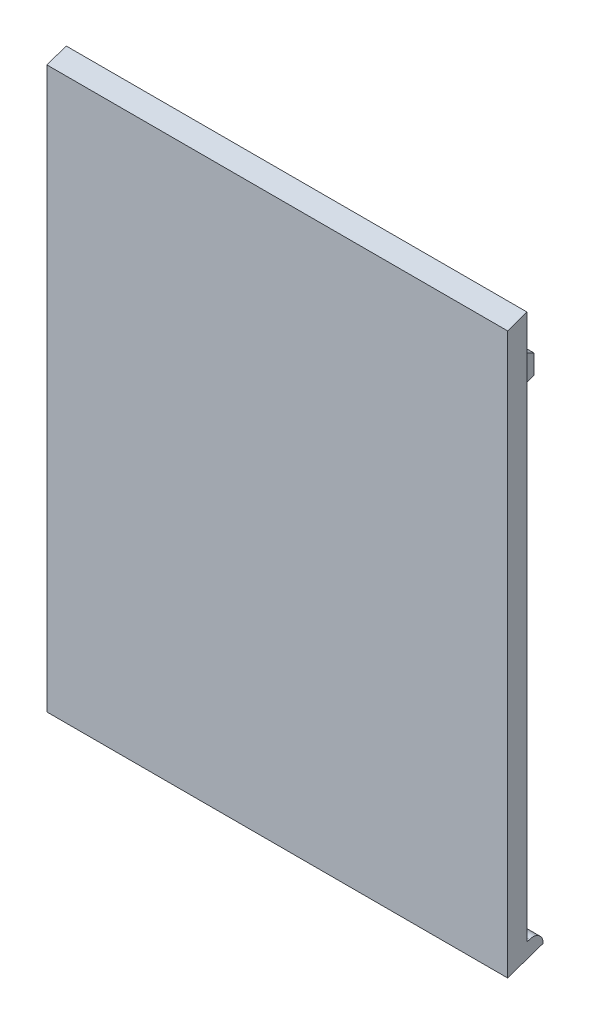
from build123d import *
from OCP.BRepFilletAPI import BRepFilletAPI_MakeChamfer

# Parameters (mm, degrees)
SALIENTE_EXTRUIR1_START   = -112.716536218
SALIENTE_EXTRUIR1_DEPTH   = 135
SALIENTE_EXTRUIR2_START   = -105.966536218
SALIENTE_EXTRUIR2_DEPTH   = 3
SALIENTE_EXTRUIR2_START_2 = 12.533463782
SALIENTE_EXTRUIR2_2_DEPTH = 3
SALIENTE_EXTRUIR2_START_3 = -102.966536218
SALIENTE_EXTRUIR2_3_DEPTH = 115.5
SALIENTE_EXTRUIR2_START_4 = -109.155348963
SALIENTE_EXTRUIR2_4_DEPTH = 3
SALIENTE_EXTRUIR2_START_5 = 15.722276527
SALIENTE_EXTRUIR2_5_DEPTH = 3
SALIENTE_EXTRUIR2_START_6 = -106.155348963
SALIENTE_EXTRUIR2_6_DEPTH = 0.188812745
SALIENTE_EXTRUIR2_START_7 = 15.533463782
SALIENTE_EXTRUIR2_7_DEPTH = 0.188812745
CORTAR_EXTRUIR1_DEPTH     = 142
SALIENTE_EXTRUIR3_START   = -67.100694653
SALIENTE_EXTRUIR3_DEPTH   = 43.76831687
CORTAR_EXTRUIR2_DEPTH     = 52
CHAFL_N1_SIZE             = 1
CHAFL_N1_SIZE2            = 0.786933748
CHAFL_N2_SIZE             = 1
CHAFL_N2_SIZE2            = 1.611265726
CHAFL_N3_SIZE             = 4
CHAFL_N3_SIZE2            = 3.141527632
CORTAR_EXTRUIR3_DEPTH     = 243
CHAFL_N4_SIZE             = 2
CHAFL_N4_SIZE2            = 1.425175398
CROQUIS7_W                = 135
CROQUIS7_H                = 4.35404101
SALIENTE_EXTRUIR4_DEPTH   = 5
REDONDEO1_R               = 3
SALIENTE_EXTRUIR5_DEPTH   = 8
CORTAR_EXTRUIR4_DEPTH     = 16
REDONDEO2_R               = 3
CORTAR_EXTRUIR5_START     = -9.75
CORTAR_EXTRUIR5_DEPTH     = 115.5
CROQUIS11_R               = 3.5
CROQUIS11_R_2             = 2
CROQUIS11_R_3             = 3
CROQUIS11_R_4             = 1.25
CROQUIS11_R_5             = 2.750806456
SALIENTE_EXTRUIR6_DEPTH   = 5


# Read off the part's stored shape, not the designer's step: Saliente-Extruir1, Saliente-Extruir2, Saliente-Extruir3
with BuildPart() as part:
    # Saliente-Extruir1 outline → Saliente-Extruir1 (new body)
    with BuildSketch(Plane.YZ.offset(SALIENTE_EXTRUIR1_START)):
        Polygon((-94.607382532, 5.674155302), (-92.657007797, 0), (71.548186707, 0), (69.597811972, 5.674155302), align=None)
    extrude(amount=SALIENTE_EXTRUIR1_DEPTH)

    # Saliente-Extruir2 outline → Saliente-Extruir2 (add)
    with BuildSketch(Plane.YZ.offset(SALIENTE_EXTRUIR2_START)):
        Polygon((-88.302966787, 0), (-86.352592053, -5.674155302), (53.883350011, -5.674155302), (51.932975277, 0), align=None)
    extrude(amount=SALIENTE_EXTRUIR2_DEPTH)

    # Saliente-Extruir2 2 outline → Saliente-Extruir2 2 (add)
    with BuildSketch(Plane.YZ.offset(SALIENTE_EXTRUIR2_START_2)):
        Polygon((-88.302966787, 0), (-86.352592053, -5.674155302), (53.883350011, -5.674155302), (51.932975277, 0), align=None)
    extrude(amount=SALIENTE_EXTRUIR2_2_DEPTH)

    # Saliente-Extruir2 3 outline → Saliente-Extruir2 3 (add)
    with BuildSketch(Plane.YZ.offset(SALIENTE_EXTRUIR2_START_3)):
        Polygon((-85.302966787, 0), (-88.302966787, 0), (-86.352592053, -5.674155302), (-83.352592053, -5.674155302), align=None)
    extrude(amount=SALIENTE_EXTRUIR2_3_DEPTH)

    # Saliente-Extruir2 4 outline → Saliente-Extruir2 4 (add)
    with BuildSketch(Plane.YZ.offset(SALIENTE_EXTRUIR2_START_4)):
        Polygon((48.932975277, 0), (50.883350011, -5.674155302), (63.313045378, -5.674155302), (61.362670643, 0), align=None)
    extrude(amount=SALIENTE_EXTRUIR2_4_DEPTH)

    # Saliente-Extruir2 5 outline → Saliente-Extruir2 5 (add)
    with BuildSketch(Plane.YZ.offset(SALIENTE_EXTRUIR2_START_5)):
        Polygon((48.932975277, 0), (50.883350011, -5.674155302), (63.313045378, -5.674155302), (61.362670643, 0), align=None)
    extrude(amount=SALIENTE_EXTRUIR2_5_DEPTH)

    # Saliente-Extruir2 6 outline → Saliente-Extruir2 6 (add)
    with BuildSketch(Plane.YZ.offset(SALIENTE_EXTRUIR2_START_6)):
        Polygon((51.932975277, 0), (48.932975277, 0), (50.883350011, -5.674155302), (53.883350011, -5.674155302), align=None)
    extrude(amount=SALIENTE_EXTRUIR2_6_DEPTH)

    # Saliente-Extruir2 7 outline → Saliente-Extruir2 7 (add)
    with BuildSketch(Plane.YZ.offset(SALIENTE_EXTRUIR2_START_7)):
        Polygon((51.932975277, 0), (48.932975277, 0), (50.883350011, -5.674155302), (53.883350011, -5.674155302), align=None)
    extrude(amount=SALIENTE_EXTRUIR2_7_DEPTH)

    # Croquis3 → Cortar-Extruir1 (cut)
    with BuildSketch(Plane(origin=(18.722276527, 0, 0), x_dir=(0, 0, -1), z_dir=(1, 0, 0))):
        Polygon((5.674155302, 59.663045378), (0, 57.686858925), (0, 61.691536691), (6.106990738, 63.936404196), (5.897646794, 59.689197808), align=None)
    extrude(amount=-CORTAR_EXTRUIR1_DEPTH, mode=Mode.SUBTRACT)

    # Saliente-Extruir3 outline → Saliente-Extruir3 (add)
    with BuildSketch(Plane.YZ.offset(SALIENTE_EXTRUIR3_START)):
        Polygon((67.89512648, -3.782770202), (66.594876657, 0), (64.112670643, 0), (65.412920466, -3.782770202), align=None)
    extrude(amount=SALIENTE_EXTRUIR3_DEPTH)

    # Croquis5 → Cortar-Extruir2 (cut)
    with BuildSketch(Plane.ZY.offset(67.100694653)):
        Polygon((0, 64.112670643), (-3.782770202, 65.412920466), (-3.782770202, 65.812920466), (0, 64.512670643), align=None)
    extrude(amount=-CORTAR_EXTRUIR2_DEPTH, mode=Mode.SUBTRACT)

    # Chaflán1
    chafl_n1_edges = [part.edges().sort_by_distance(p)[0] for p in [
        (-45.216536218, 67.89512648, -3.782770202),
    ]]
    chafl_n1_side = [part.faces().sort_by_distance(p)[0] for p in [
        (-45.216536218, 67.245001569, -1.891385101),
    ]]
    chamfer(chafl_n1_edges, length=CHAFL_N1_SIZE, length2=CHAFL_N1_SIZE2, reference=chafl_n1_side[0])

    # Chaflán2
    chafl_n2_edges = [part.edges().sort_by_distance(p)[0] for p in [
        (-45.216536218, 65.812920466, -3.782770202),
    ]]
    chafl_n2_side = [part.faces().sort_by_distance(p)[0] for p in [
        (-45.216536218, 66.460556599, -3.782770202),
    ]]
    chamfer(chafl_n2_edges, length=CHAFL_N2_SIZE, length2=CHAFL_N2_SIZE2, reference=chafl_n2_side[0])

    # Chaflán3: one chamfer whose edges measure the first distance from different faces: ONE call of the kernel's chamfer builder (chamfer() names one face for all edges)
    chafl_n3_edges_1 = [part.edges().sort_by_distance(p)[0] for p in [
        (17.222276527, 59.663045378, -5.674155302),
    ]]
    chafl_n3_side_1 = [part.faces().sort_by_distance(p)[0] for p in [
        (17.222276527, 58.674952151, -2.837077651),
    ]]
    chafl_n3_edges_2 = [part.edges().sort_by_distance(p)[0] for p in [
        (-107.655348963, 59.663045378, -5.674155302),
    ]]
    chafl_n3_side_2 = [part.faces().sort_by_distance(p)[0] for p in [
        (-107.655348963, 58.674952151, -2.837077651),
    ]]
    chafl_n3 = BRepFilletAPI_MakeChamfer(part.part.solid().wrapped)
    for e in chafl_n3_edges_1:
        chafl_n3.Add(CHAFL_N3_SIZE, CHAFL_N3_SIZE2, e.wrapped, chafl_n3_side_1[0].wrapped)  # the first distance lies on this face
    for e in chafl_n3_edges_2:
        chafl_n3.Add(CHAFL_N3_SIZE, CHAFL_N3_SIZE2, e.wrapped, chafl_n3_side_2[0].wrapped)  # the first distance lies on this face
    add(Compound.cast(chafl_n3.Shape()), mode=Mode.REPLACE)

    # Croquis6 → Cortar-Extruir3 (cut)
    with BuildSketch(Plane(origin=(15.533463782, 0, 0), x_dir=(0, 0, -1), z_dir=(1, 0, 0))):
        Polygon((1.138067307, -87.911779447), (5.674155302, -74.677839868), (7.462563926, -80.875468684), (5.674155302, -88.836341828), (1.028411824, -88.836341828), align=None)
    extrude(amount=-CORTAR_EXTRUIR3_DEPTH, mode=Mode.SUBTRACT)

    # Chaflán4
    chafl_n4_edges = [part.edges().sort_by_distance(p)[0] for p in [
        (-45.216536218, -84.511123218, -2.303682112),
    ]]
    chafl_n4_side = [part.faces().sort_by_distance(p)[0] for p in [
        (-45.216536218, -85.384648624, -2.004271034),
    ]]
    chamfer(chafl_n4_edges, length=CHAFL_N4_SIZE, length2=CHAFL_N4_SIZE2, reference=chafl_n4_side[0])

    # Croquis7 → Saliente-Extruir4 (add, along a direction that is not the sketch's normal)
    with BuildSketch(Plane(origin=(0, 0, 0), x_dir=(-1, 0, 0), z_dir=(0, 0, -1))):
        with Locations((45.216536218, -90.479987292)):
            Rectangle(CROQUIS7_W, CROQUIS7_H)
    extrude(amount=SALIENTE_EXTRUIR4_DEPTH, dir=(0, 0.3250624557733218, -0.9456925503812629))

    # Redondeo1
    # the kernel refuses this fillet: 3 mm, written as the material it takes off along each edge
    with BuildSketch(Plane(origin=(32.792131123, -86.677654508, -4.728462752), x_dir=(0, -0.325062455773321, 0.945692550381263), z_dir=(-1, 0, 0))) as redondeo1_piece_1_section:
        with BuildLine():
            CenterArc((REDONDEO1_R * 1.40115564539, -REDONDEO1_R), REDONDEO1_R, 90, 108.969358895)
            Line((REDONDEO1_R * 0.455463095012, -REDONDEO1_R * 1.32506245577), (0, 0))
            Line((0, 0), (REDONDEO1_R * 1.40115564539, 0))
        make_face()
    redondeo1_piece_1 = extrude(amount=156.017334681, mode=Mode.PRIVATE)
    redondeo1_piece_1 = split(redondeo1_piece_1, bisect_by=Plane(origin=(24.162797452, -87.99794968, -1.108531449), z_dir=(0, 0.3242435571173952, 0.945973633706489)), keep=Keep.TOP, mode=Mode.PRIVATE)
    redondeo1_piece_1 = split(redondeo1_piece_1, bisect_by=Plane(origin=(15.533463782, -87.946261659, -0.957732753), z_dir=(1, 0, 0)), keep=Keep.TOP, mode=Mode.PRIVATE)
    add(redondeo1_piece_1, mode=Mode.SUBTRACT)
    with BuildSketch(Plane(origin=(32.792131123, -86.677654508, -4.728462752), x_dir=(0, -0.325062455773321, 0.945692550381263), z_dir=(-1, 0, 0))) as redondeo1_piece_2_section:
        with BuildLine():
            CenterArc((REDONDEO1_R * 1.40115564539, -REDONDEO1_R), REDONDEO1_R, 90, 108.969358895)
            Line((REDONDEO1_R * 0.455463095012, -REDONDEO1_R * 1.32506245577), (0, 0))
            Line((0, 0), (REDONDEO1_R * 1.40115564539, 0))
        make_face()
    redondeo1_piece_2 = extrude(amount=156.017334681, mode=Mode.PRIVATE)
    redondeo1_piece_2 = split(redondeo1_piece_2, bisect_by=Plane(origin=(24.162797452, -87.17098593, -1.391982973), z_dir=(0, -0.3242435571173952, -0.945973633706489)), keep=Keep.TOP, mode=Mode.PRIVATE)
    redondeo1_piece_2 = split(redondeo1_piece_2, bisect_by=Plane(origin=(15.533463782, -87.997966874, -3.804682167), z_dir=(1, 0, 0)), keep=Keep.TOP, mode=Mode.PRIVATE)
    add(redondeo1_piece_2, mode=Mode.SUBTRACT)
    with BuildSketch(Plane(origin=(32.792131123, -86.677654508, -4.728462752), x_dir=(0, -0.325062455773321, 0.945692550381263), z_dir=(-1, 0, 0))) as redondeo1_piece_3_section:
        with BuildLine():
            CenterArc((REDONDEO1_R * 1.40115564539, -REDONDEO1_R), REDONDEO1_R, 90, 108.969358895)
            Line((REDONDEO1_R * 0.455463095012, -REDONDEO1_R * 1.32506245577), (0, 0))
            Line((0, 0), (REDONDEO1_R * 1.40115564539, 0))
        make_face()
    redondeo1_piece_3 = extrude(amount=156.017334681, mode=Mode.PRIVATE)
    redondeo1_piece_3 = split(redondeo1_piece_3, bisect_by=Plane(origin=(-45.216536218, -87.17098593, -1.391982973), z_dir=(0, -0.3242435571173952, -0.945973633706489)), keep=Keep.TOP, mode=Mode.PRIVATE)
    redondeo1_piece_3 = split(redondeo1_piece_3, bisect_by=Plane(origin=(15.533463782, -87.997966874, -3.804682167), z_dir=(-1, 0, 0)), keep=Keep.TOP, mode=Mode.PRIVATE)
    redondeo1_piece_3 = split(redondeo1_piece_3, bisect_by=Plane(origin=(-105.966536218, -87.997966874, -3.804682167), z_dir=(1, 0, 0)), keep=Keep.TOP, mode=Mode.PRIVATE)
    add(redondeo1_piece_3, mode=Mode.SUBTRACT)
    with BuildSketch(Plane(origin=(32.792131123, -86.677654508, -4.728462752), x_dir=(0, -0.325062455773321, 0.945692550381263), z_dir=(-1, 0, 0))) as redondeo1_piece_4_section:
        with BuildLine():
            CenterArc((REDONDEO1_R * 1.40115564539, -REDONDEO1_R), REDONDEO1_R, 90, 108.969358895)
            Line((REDONDEO1_R * 0.455463095012, -REDONDEO1_R * 1.32506245577), (0, 0))
            Line((0, 0), (REDONDEO1_R * 1.40115564539, 0))
        make_face()
    redondeo1_piece_4 = extrude(amount=156.017334681, mode=Mode.PRIVATE)
    redondeo1_piece_4 = split(redondeo1_piece_4, bisect_by=Plane(origin=(-114.595869888, -87.99794968, -1.108531449), z_dir=(0, 0.3242435571173952, 0.945973633706489)), keep=Keep.TOP, mode=Mode.PRIVATE)
    redondeo1_piece_4 = split(redondeo1_piece_4, bisect_by=Plane(origin=(-105.966536218, -87.946261659, -0.957732753), z_dir=(-1, 0, 0)), keep=Keep.TOP, mode=Mode.PRIVATE)
    add(redondeo1_piece_4, mode=Mode.SUBTRACT)
    with BuildSketch(Plane(origin=(32.792131123, -86.677654508, -4.728462752), x_dir=(0, -0.325062455773321, 0.945692550381263), z_dir=(-1, 0, 0))) as redondeo1_piece_5_section:
        with BuildLine():
            CenterArc((REDONDEO1_R * 1.40115564539, -REDONDEO1_R), REDONDEO1_R, 90, 108.969358895)
            Line((REDONDEO1_R * 0.455463095012, -REDONDEO1_R * 1.32506245577), (0, 0))
            Line((0, 0), (REDONDEO1_R * 1.40115564539, 0))
        make_face()
    redondeo1_piece_5 = extrude(amount=156.017334681, mode=Mode.PRIVATE)
    redondeo1_piece_5 = split(redondeo1_piece_5, bisect_by=Plane(origin=(-114.595869888, -87.17098593, -1.391982973), z_dir=(0, -0.3242435571173952, -0.945973633706489)), keep=Keep.TOP, mode=Mode.PRIVATE)
    redondeo1_piece_5 = split(redondeo1_piece_5, bisect_by=Plane(origin=(-105.966536218, -87.997966874, -3.804682167), z_dir=(-1, 0, 0)), keep=Keep.TOP, mode=Mode.PRIVATE)
    add(redondeo1_piece_5, mode=Mode.SUBTRACT)

    # Croquis8 → Saliente-Extruir5 (add)
    with BuildSketch(Plane(origin=(0, 0, 0), x_dir=(-1, 0, 0), z_dir=(0, 0, -1))):
        Polygon((39.180876317, -2.605289364), (39.180876317, -47.959276742), (50.680876317, -47.959276742), (50.680876317, -2.605289364), (44.930876317, -2.605289364), align=None)
    extrude(amount=SALIENTE_EXTRUIR5_DEPTH)

    # Croquis9 → Cortar-Extruir4 (cut)
    with BuildSketch(Plane.ZY.offset(50.680876317)):
        with BuildLine():
            Line((-5.944216718, -6.205289364), (-5.944216718, -44.359276742))
            ThreePointArc((-5.944216718, -44.359276742), (-4, -46.30349346), (-2.055783282, -44.359276742))
            Line((-2.055783282, -44.359276742), (-2.055783282, -6.205289364))
            ThreePointArc((-2.055783282, -6.205289364), (-4, -4.261072646), (-5.944216718, -6.205289364))
        make_face()
    extrude(amount=-CORTAR_EXTRUIR4_DEPTH, mode=Mode.SUBTRACT)

    # Redondeo2
    redondeo2_edges = [part.edges().sort_by_distance(p)[0] for p in [
        (-44.930876317, -2.605289364, -8),
        (-44.930876317, -47.959276742, -8),
    ]]
    fillet(redondeo2_edges, radius=REDONDEO2_R)

    # Croquis10 → Cortar-Extruir5 (cut)
    with BuildSketch(Plane(origin=(22.283463782, 0, 0), x_dir=(0, 0, -1), z_dir=(1, 0, 0)).offset(CORTAR_EXTRUIR5_START)):
        with BuildLine():
            Line((0, -88.302966787), (0, -83.901289326))
            Line((0, -83.901289326), (-1.556763584, -83.901289326))
            Line((-1.556763584, -83.901289326), (-1.556763584, -89.434140922))
            Line((-1.556763584, -89.434140922), (4.356436756, -89.434140922))
            ThreePointArc((4.356436756, -89.434140922), (2.808286082, -88.082196369), (0.753275385, -88.044043793))
            Line((0.753275385, -88.044043793), (0, -88.302966787))
        make_face()
        with BuildLine():
            Line((1.333248246, -84.585765812), (0, -83.901289326))
            Line((0, -83.901289326), (0, -88.302966787))
            Line((0, -88.302966787), (0.753275385, -88.044043793))
            ThreePointArc((0.753275385, -88.044043793), (2.808286082, -88.082196369), (4.356436756, -89.434140922))
            Line((4.356436756, -89.434140922), (4.565498319, -89.434140922))
            Line((4.565498319, -89.434140922), (1.333248246, -84.585765812))
        make_face()
    extrude(amount=-CORTAR_EXTRUIR5_DEPTH, mode=Mode.SUBTRACT)

    # Croquis11 → Saliente-Extruir6 (add)
    # profile 1 of 11: a face of its own
    with BuildSketch(Plane(origin=(0, 0, 0), x_dir=(-1, 0, 0), z_dir=(0, 0, -1))):
        with Locations((8.812099275, -16.74268297)):
            Circle(CROQUIS11_R)
        with Locations((8.812099275, -16.74268297)):
            Circle(CROQUIS11_R_2, mode=Mode.SUBTRACT)
    # profile 2 of 11: a face of its own
    with BuildSketch(Plane(origin=(0, 0, 0), x_dir=(-1, 0, 0), z_dir=(0, 0, -1))):
        with Locations((8.812099275, 38.88331703)):
            Circle(CROQUIS11_R)
        with Locations((8.812099275, 38.88331703)):
            Circle(CROQUIS11_R_2, mode=Mode.SUBTRACT)
    # profile 3 of 11: a face of its own
    with BuildSketch(Plane(origin=(0, 0, 0), x_dir=(-1, 0, 0), z_dir=(0, 0, -1))):
        with Locations((73.360883811, 15.114409269)):
            Circle(CROQUIS11_R)
        with Locations((73.360883811, 15.114409269)):
            Circle(CROQUIS11_R_2, mode=Mode.SUBTRACT)
    # profile 4 of 11: a face of its own
    with BuildSketch(Plane(origin=(0, 0, 0), x_dir=(-1, 0, 0), z_dir=(0, 0, -1))):
        with Locations((97.860883811, 15.114409269)):
            Circle(CROQUIS11_R)
        with Locations((97.860883811, 15.114409269)):
            Circle(CROQUIS11_R_2, mode=Mode.SUBTRACT)
    # profile 5 of 11: a face of its own
    with BuildSketch(Plane(origin=(0, 0, 0), x_dir=(-1, 0, 0), z_dir=(0, 0, -1))):
        with Locations((73.360883811, -31.385590731)):
            Circle(CROQUIS11_R_2)
    # profile 6 of 11: a face of its own
    with BuildSketch(Plane(origin=(0, 0, 0), x_dir=(-1, 0, 0), z_dir=(0, 0, -1))):
        with Locations((97.860883811, -31.385590731)):
            Circle(CROQUIS11_R_2)
    # profile 7 of 11: a face of its own
    with BuildSketch(Plane(origin=(0, 0, 0), x_dir=(-1, 0, 0), z_dir=(0, 0, -1))):
        with Locations((1.144671317, -46.93983138)):
            Circle(CROQUIS11_R)
        with Locations((1.144671317, -46.93983138)):
            Circle(CROQUIS11_R_2, mode=Mode.SUBTRACT)
    # profile 8 of 11: a face of its own
    with BuildSketch(Plane(origin=(0, 0, 0), x_dir=(-1, 0, 0), z_dir=(0, 0, -1))):
        with Locations((10.144671317, -46.93983138)):
            Circle(CROQUIS11_R)
        with Locations((10.144671317, -46.93983138)):
            Circle(CROQUIS11_R_2, mode=Mode.SUBTRACT)
    # profile 9 of 11: a face of its own
    with BuildSketch(Plane(origin=(0, 0, 0), x_dir=(-1, 0, 0), z_dir=(0, 0, -1))):
        with Locations((61.552826127, 54.100251176)):
            Circle(CROQUIS11_R_3)
        with Locations((61.552826127, 54.100251176)):
            Circle(CROQUIS11_R_4, mode=Mode.SUBTRACT)
    # profile 10 of 11: a face of its own
    with BuildSketch(Plane(origin=(0, 0, 0), x_dir=(-1, 0, 0), z_dir=(0, 0, -1))):
        with Locations((61.552826127, 36.260251176)):
            Circle(CROQUIS11_R_3)
        with Locations((61.552826127, 36.260251176)):
            Circle(CROQUIS11_R_4, mode=Mode.SUBTRACT)
    # profile 11 of 11: a face of its own
    with BuildSketch(Plane(origin=(0, 0, 0), x_dir=(-1, 0, 0), z_dir=(0, 0, -1))):
        with Locations((29.662826127, 45.090251176)):
            Circle(CROQUIS11_R_5)
    extrude(amount=SALIENTE_EXTRUIR6_DEPTH)


solid = part.part
